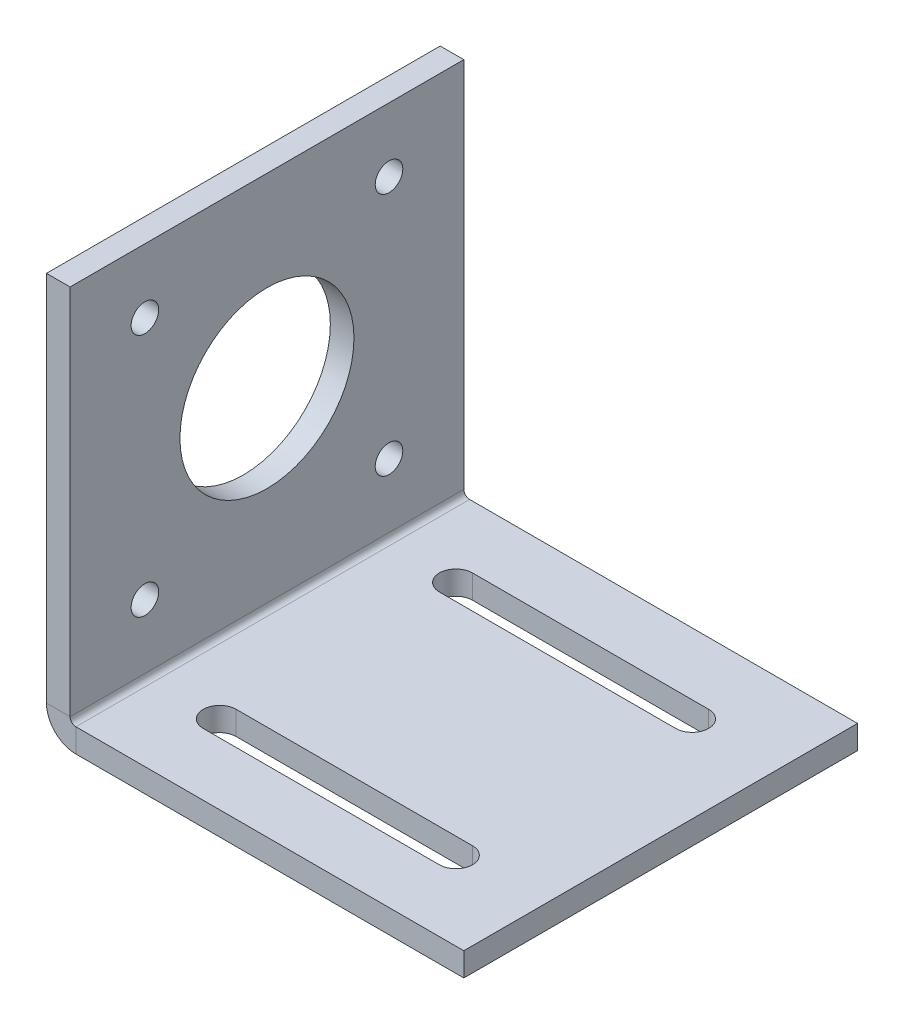
from build123d import *

# Parameters (mm, degrees)
SM_BASE_FLANGE_1_DEPTH = 50
SKETCH_7_R             = 11.05
SKETCH_7_R_2           = 1.75
CUT_EXTRUDE_1_DEPTH    = 10
CUT_EXTRUDE_2_DEPTH    = 10


# Sheet-metal steps are written as plain solids
with BuildPart() as part:
    # Sketch 2 → 基体-法兰1 (new body)
    with BuildSketch(Plane.XY):
        with BuildLine():
            Line((50, 0), (0.7366, 0))
            ThreePointArc((0.7366, 0), (0.215745145, 0.215745145), (0, 0.7366))
            Line((0, 0.7366), (0, 48))
            Line((0, 48), (-3, 48))
            Line((-3, 48), (-3, 0.7366))
            ThreePointArc((-3, 0.7366), (-1.905575199, -1.905575199), (0.7366, -3))
            Line((0.7366, -3), (50, -3))
            Line((50, -3), (50, 0))
        make_face()
    extrude(amount=SM_BASE_FLANGE_1_DEPTH)

    # 草图7 → 切除-拉伸1 (cut)
    with BuildSketch(Plane(origin=(0, 0, 0), x_dir=(0, 0, -1), z_dir=(1, 0, 0))):
        with Locations((-25, 24.3683)):
            Circle(SKETCH_7_R)
        with Locations((-40.5, 39.8683)):
            Circle(SKETCH_7_R_2)
        with Locations((-9.5, 39.8683)):
            Circle(SKETCH_7_R_2)
        with Locations((-40.5, 8.8683)):
            Circle(SKETCH_7_R_2)
        with Locations((-9.5, 8.8683)):
            Circle(SKETCH_7_R_2)
    extrude(amount=-CUT_EXTRUDE_1_DEPTH, mode=Mode.SUBTRACT)

    # 草图8 → 切除-拉伸2 (cut)
    with BuildSketch(Plane(origin=(0, 0, 0), x_dir=(1, 0, 0), z_dir=(0, 1, 0))):
        with BuildLine():
            Line((9, -12.1), (39, -12.1))
            ThreePointArc((39, -12.1), (41.1, -10), (39, -7.9))
            Line((39, -7.9), (9, -7.9))
            ThreePointArc((9, -7.9), (6.9, -10), (9, -12.1))
        make_face()
        with BuildLine():
            Line((9, -42.1), (39, -42.1))
            ThreePointArc((39, -42.1), (41.1, -40), (39, -37.9))
            Line((39, -37.9), (9, -37.9))
            ThreePointArc((9, -37.9), (6.9, -40), (9, -42.1))
        make_face()
    extrude(amount=-CUT_EXTRUDE_2_DEPTH, mode=Mode.SUBTRACT)


solid = part.part
